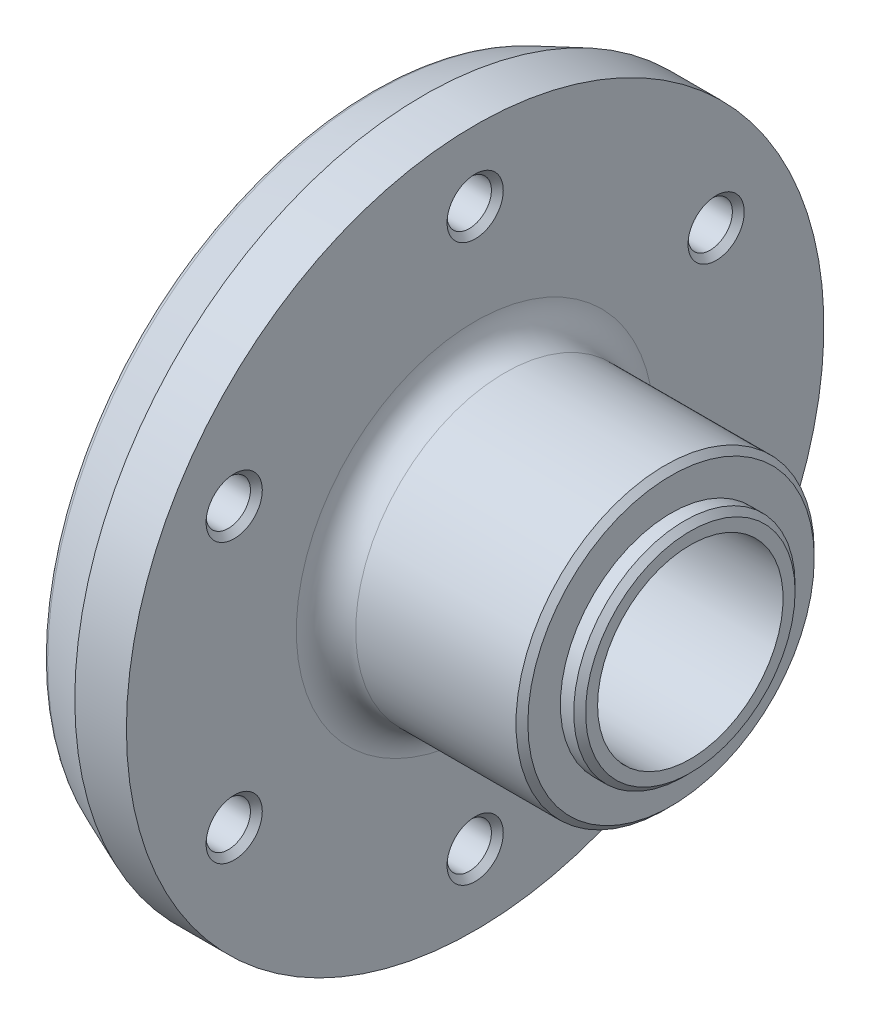
from build123d import *

# Parameters (mm, degrees)
SKETCH2_R                        = 12.7635
BOSS_EXTRUDE1_DEPTH              = 16.764
SKETCH3_R                        = 9.4742
BOSS_EXTRUDE2_DEPTH              = 1.651
F_5_8_0_625_DIAMETER_HOLE1_D     = 15.875
F_25_0_1495_DIAMETER_HOLE1_D     = 3.7973
F_25_0_1495_DIAMETER_HOLE2_D     = 3.7973
F_25_0_1495_DIAMETER_HOLE2_DEPTH = 27.432
CHAMFER1_SIZE                    = 0.508000007
CHAMFER2_SIZE                    = 0.277345319
CHAMFER2_SIZE2                   = 0.762
FILLET1_R                        = 1.016
FILLET2_R                        = 2.54


with BuildPart() as part:
    # Sketch1 → Revolve1 (revolve)
    with BuildSketch(Plane(origin=(0, 0, 0), x_dir=(-1, 0, 0), z_dir=(0, 0, -1))):
        Polygon((-55.88, 29.845), (-55.88, 0), (-46.863, 0), (-46.863, 27.94), (-51.462076836, 29.845), align=None)
    revolve(axis=Axis((55.88, 0, 0), (-1, 0, 0)))

    # Sketch2 → Boss-Extrude1 (add)
    with BuildSketch(Plane(origin=(55.88, 0, 0), x_dir=(0, 0, -1), z_dir=(1, 0, 0))):
        Circle(SKETCH2_R)
    extrude(amount=BOSS_EXTRUDE1_DEPTH)

    # Sketch3 → Boss-Extrude2 (add)
    with BuildSketch(Plane(origin=(72.644, 0, 0), x_dir=(0, 0, -1), z_dir=(1, 0, 0))):
        Circle(SKETCH3_R)
    extrude(amount=BOSS_EXTRUDE2_DEPTH)

    # 5/8 (0.625) Diameter Hole1 (through all)
    with Locations(Plane.ZY.offset(-46.863)):
        with Locations((0, 0)):
            Hole(F_5_8_0_625_DIAMETER_HOLE1_D / 2)

    # #25 (0.1495) Diameter Hole1 (through all)
    with Locations(Plane(origin=(55.88, 0, 0), x_dir=(0, 0, -1), z_dir=(1, 0, 0))):
        with Locations((-20.622229928, 11.90625), (20.622229928, 11.90625), (20.622229928, -11.90625), (0, -23.8125)):
            Hole(F_25_0_1495_DIAMETER_HOLE1_D / 2)

    # #25 (0.1495) Diameter Hole2
    with Locations(Plane.ZY.offset(-46.863)):
        with Locations((20.622229928, -11.90625), (0, 23.8125)):
            Hole(F_25_0_1495_DIAMETER_HOLE2_D / 2, depth=F_25_0_1495_DIAMETER_HOLE2_DEPTH)

    # Chamfer1
    chamfer1_edges = [part.edges().sort_by_distance(p)[0] for p in [
        (46.863, 11.90625, 18.723579928),
        (46.863, -23.8125, -1.89865),
        (46.863, 11.90625, -22.520879928),
        (55.88, 11.90625, 18.723579928),
        (55.88, -11.90625, 22.520879928),
        (55.88, 23.8125, 1.89865),
        (46.863, 23.8125, 1.89865),
        (55.88, 11.90625, -22.520879928),
        (46.863, -11.90625, -22.520879928),
        (55.88, -11.90625, -22.520879928),
        (74.295, 0, 9.4742),
        (72.644, 0, 12.7635),
        (55.88, -23.8125, -1.89865),
        (46.863, -11.90625, 22.520879928),
    ]]
    chamfer(chamfer1_edges, length=CHAMFER1_SIZE)

    # Chamfer2
    chamfer2_edges = [part.edges().sort_by_distance(p)[0] for p in [
        (46.863, 0, 7.9375),
    ]]
    chamfer2_side = [part.faces().sort_by_distance(p)[0] for p in [
        (46.863, 11.90625, 17.425317382),
    ]]
    chamfer(chamfer2_edges, length=CHAMFER2_SIZE, length2=CHAMFER2_SIZE2, reference=chamfer2_side[0])

    # Fillet1
    fillet1_edges = [part.edges().sort_by_distance(p)[0] for p in [
        (46.863, -27.94, 0),
    ]]
    fillet(fillet1_edges, radius=FILLET1_R)

    # Fillet2
    fillet2_edges = [part.edges().sort_by_distance(p)[0] for p in [
        (55.88, 0, 12.7635),
    ]]
    fillet(fillet2_edges, radius=FILLET2_R)


solid = part.part
